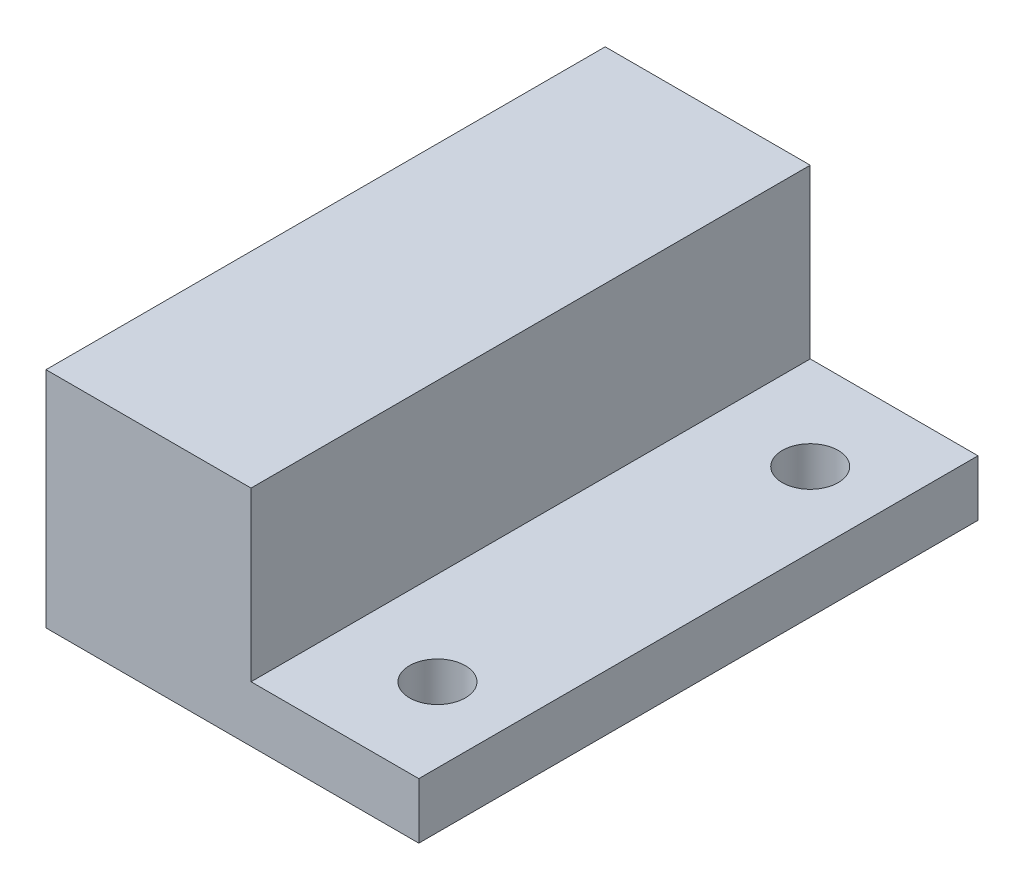
from build123d import *

# Parameters (mm, degrees)
SKETCH1_W           = 25.4
SKETCH1_H           = 38.1
SKETCH1_R           = 1.905
BOSS_EXTRUDE1_DEPTH = 3.81
BOSS_EXTRUDE2_DEPTH = 8.89
SKETCH3_W           = 13.97
SKETCH3_H           = 38.1
BOSS_EXTRUDE3_DEPTH = 2.54
CHAMFER1_SIZE       = 1.27


with BuildPart() as part:
    # Sketch1 → Boss-Extrude1 (new body)
    with BuildSketch(Plane(origin=(0, 0, 0), x_dir=(1, 0, 0), z_dir=(0, 1, 0))):
        with Locations((-7.62, -12.7)):
            Rectangle(SKETCH1_W, SKETCH1_H)
        Circle(SKETCH1_R, mode=Mode.SUBTRACT)
        with Locations((0, -25.4)):
            Circle(SKETCH1_R, mode=Mode.SUBTRACT)
    extrude(amount=BOSS_EXTRUDE1_DEPTH)

    # Sketch2 → Boss-Extrude2 (add)
    with BuildSketch(Plane(origin=(0, 3.81, 0), x_dir=(1, 0, 0), z_dir=(0, 1, 0))):
        Polygon((-20.32, 6.35), (-20.32, -31.75), (-6.35, -31.75), (-6.35, 6.35), (-8.89, 6.35), (-8.89, -29.21), (-17.78, -29.21), (-17.78, 6.35), align=None)
    extrude(amount=BOSS_EXTRUDE2_DEPTH)

    # Sketch3 → Boss-Extrude3 (add)
    with BuildSketch(Plane(origin=(0, 12.7, 0), x_dir=(1, 0, 0), z_dir=(0, 1, 0))):
        with Locations((-13.335, -12.7)):
            Rectangle(SKETCH3_W, SKETCH3_H)
    extrude(amount=BOSS_EXTRUDE3_DEPTH)

    # Chamfer1
    chamfer1_edges = [part.edges().sort_by_distance(p)[0] for p in [
        (-8.89, 12.7, 11.43),
        (-17.78, 12.7, 11.43),
    ]]
    chamfer(chamfer1_edges, length=CHAMFER1_SIZE)


solid = part.part
